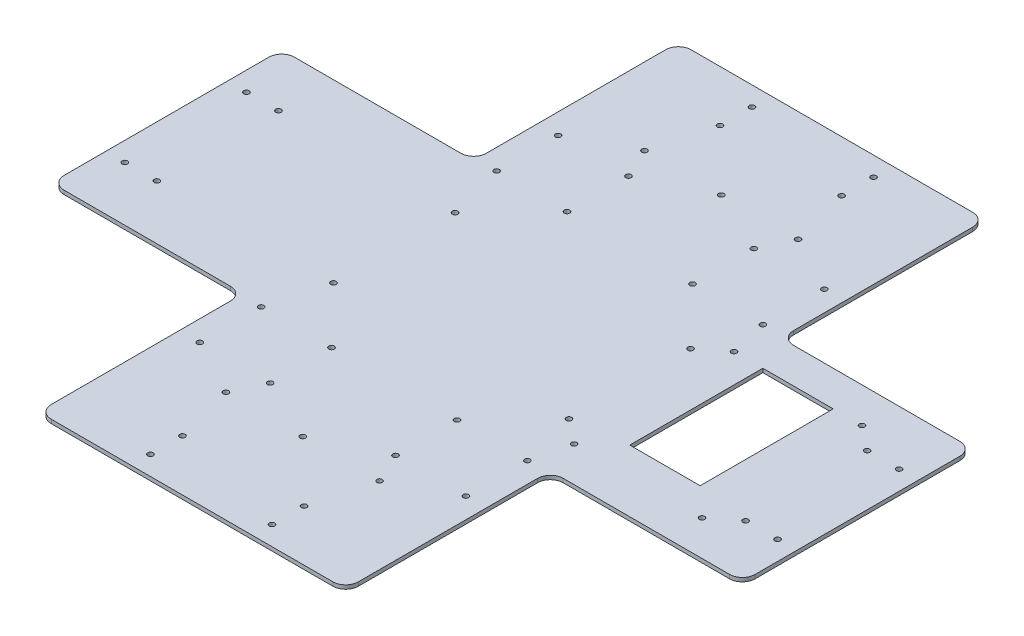
from build123d import *

# Parameters (mm, degrees)
BASE_DEPTH               = 3
FILLET1_R                = 10
SKETCH2_R                = 2.125
ARMOR_MODULE_HOLES_DEPTH = 3
SKETCH3_R                = 2.125
PLATES_FOR_GIMBAL_DEPTH  = 3
SKETCH5_R                = 2.125
SUSPENSION_MOUNT_DEPTH   = 10
SKETCH6_R                = 2.125
SKETCH6_W                = 55
SKETCH6_H                = 104
BATTERY_MOUNT_DEPTH      = 10
SKETCH7_R                = 2.1
SKETCH7_R_2              = 2.125
CUT_EXTRUDE1_DEPTH       = 10


with BuildPart() as part:
    # Sketch1 → Base (new body)
    with BuildSketch(Plane(origin=(0, 0, 0), x_dir=(1, 0, 0), z_dir=(0, 1, 0))):
        Polygon((120, 250), (-120, 250), (-120, 90), (-270, 90), (-270, -90), (-120, -90), (-120, -250), (120, -250), (120, -90), (270, -90), (270, 90), (120, 90), align=None)
    extrude(amount=BASE_DEPTH)

    # Fillet1
    fillet1_edges = [part.edges().sort_by_distance(p)[0] for p in [
        (120, 1.5, -90),
        (270, 1.5, -90),
        (270, 1.5, 90),
        (120, 1.5, 90),
        (120, 1.5, 250),
        (-120, 1.5, 250),
        (-120, 1.5, 90),
        (-270, 1.5, 90),
        (-270, 1.5, -90),
        (-120, 1.5, -90),
        (-120, 1.5, -250),
        (120, 1.5, -250),
    ]]
    fillet(fillet1_edges, radius=FILLET1_R)

    # Sketch2 → Armor Module Holes (cut)
    with BuildSketch(Plane(origin=(0, 3, 0), x_dir=(1, 0, 0), z_dir=(0, 1, 0))):
        with Locations((-47.5, 235)):
            Circle(SKETCH2_R)
        with Locations((-47.5, 210)):
            Circle(SKETCH2_R)
        with Locations((-255, 47.5)):
            Circle(SKETCH2_R)
        with Locations((-230, 47.5)):
            Circle(SKETCH2_R)
        with Locations((-230, -47.5)):
            Circle(SKETCH2_R)
        with Locations((-255, -47.5)):
            Circle(SKETCH2_R)
        with Locations((255, -47.5)):
            Circle(SKETCH2_R)
        with Locations((230, -47.5)):
            Circle(SKETCH2_R)
        with Locations((230, 47.5)):
            Circle(SKETCH2_R)
        with Locations((255, 47.5)):
            Circle(SKETCH2_R)
        with Locations((47.5, 210)):
            Circle(SKETCH2_R)
        with Locations((47.5, 235)):
            Circle(SKETCH2_R)
        with Locations((47.5, -235)):
            Circle(SKETCH2_R)
        with Locations((47.5, -210)):
            Circle(SKETCH2_R)
        with Locations((-47.5, -210)):
            Circle(SKETCH2_R)
        with Locations((-47.5, -235)):
            Circle(SKETCH2_R)
    extrude(amount=-ARMOR_MODULE_HOLES_DEPTH, mode=Mode.SUBTRACT)

    # Sketch3 → Plates for Gimbal (cut)
    with BuildSketch(Plane(origin=(0, 3, 0), x_dir=(1, 0, 0), z_dir=(0, 1, 0))):
        with Locations((92, 47.5)):
            Circle(SKETCH3_R)
        with Locations((92, -47.5)):
            Circle(SKETCH3_R)
        with Locations((-92, -47.5)):
            Circle(SKETCH3_R)
        with Locations((-92, 47.5)):
            Circle(SKETCH3_R)
    extrude(amount=-PLATES_FOR_GIMBAL_DEPTH, mode=Mode.SUBTRACT)

    # Sketch5 → Suspension Mount (cut)
    with BuildSketch(Plane(origin=(0, 3, 0), x_dir=(1, 0, 0), z_dir=(0, 1, 0))):
        with Locations((104, -92)):
            Circle(SKETCH5_R)
        with Locations((104, -140)):
            Circle(SKETCH5_R)
        with Locations((49, -92)):
            Circle(SKETCH5_R)
        with Locations((49, -140)):
            Circle(SKETCH5_R)
        with Locations((-49, -140)):
            Circle(SKETCH5_R)
        with Locations((-49, -92)):
            Circle(SKETCH5_R)
        with Locations((-104, -140)):
            Circle(SKETCH5_R)
        with Locations((-104, -92)):
            Circle(SKETCH5_R)
        with Locations((-104, 92)):
            Circle(SKETCH5_R)
        with Locations((-104, 140)):
            Circle(SKETCH5_R)
        with Locations((-49, 92)):
            Circle(SKETCH5_R)
        with Locations((-49, 140)):
            Circle(SKETCH5_R)
        with Locations((49, 140)):
            Circle(SKETCH5_R)
        with Locations((49, 92)):
            Circle(SKETCH5_R)
        with Locations((104, 140)):
            Circle(SKETCH5_R)
        with Locations((104, 92)):
            Circle(SKETCH5_R)
    extrude(amount=-SUSPENSION_MOUNT_DEPTH, mode=Mode.SUBTRACT)

    # Sketch6 → Battery Mount (cut)
    with BuildSketch(Plane(origin=(0, 3, 0), x_dir=(1, 0, 0), z_dir=(0, 1, 0))):
        with Locations((111, -62.5)):
            Circle(SKETCH6_R)
        with Locations((211, -62.5)):
            Circle(SKETCH6_R)
        with Locations((211, 62.5)):
            Circle(SKETCH6_R)
        with Locations((111, 62.5)):
            Circle(SKETCH6_R)
        with Locations((161, 10.5)):
            Rectangle(SKETCH6_W, SKETCH6_H)
    extrude(amount=-BATTERY_MOUNT_DEPTH, mode=Mode.SUBTRACT)

    # Sketch7 → Cut-Extrude1 (cut)
    with BuildSketch(Plane(origin=(0, 3, 0), x_dir=(1, 0, 0), z_dir=(0, 1, 0))):
        with Locations((60, -163.5)):
            Circle(SKETCH7_R)
        with Locations((0, -163.5)):
            Circle(SKETCH7_R_2)
        with Locations((-60, -163.5)):
            Circle(SKETCH7_R_2)
        with Locations((-60, 163.5)):
            Circle(SKETCH7_R_2)
        with Locations((0, 163.5)):
            Circle(SKETCH7_R_2)
        with Locations((60, 163.5)):
            Circle(SKETCH7_R)
    extrude(amount=-CUT_EXTRUDE1_DEPTH, mode=Mode.SUBTRACT)


solid = part.part
